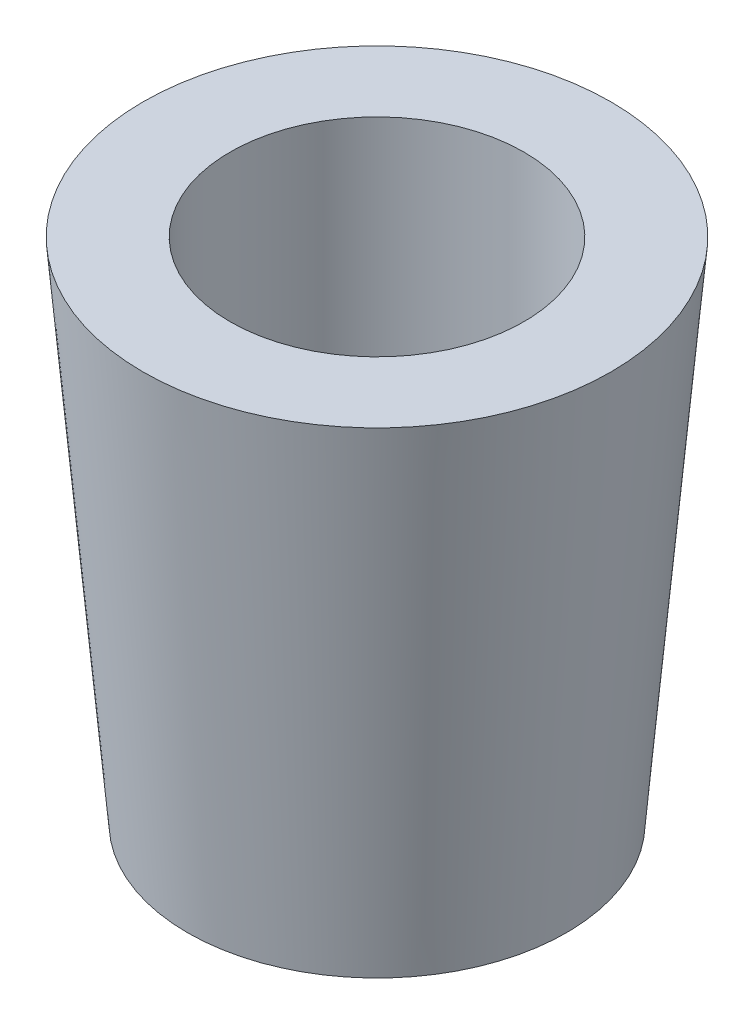
from build123d import *

# Parameters (mm, degrees)
SKETCH1_R           = 11.7
BOSS_EXTRUDE1_DEPTH = 25.4
BOSS_EXTRUDE1_DRAFT = -5
SKETCH2_R           = 3.175
CUT_EXTRUDE1_DEPTH  = 31.314023158
SKETCH9_R           = 7.35
CUT_EXTRUDE3_DEPTH  = 12.7


with BuildPart() as part:
    # Sketch1 → Boss-Extrude1 (with draft: the straight prism first)
    with BuildSketch(Plane(origin=(0, 0, 0), x_dir=(1, 0, 0), z_dir=(0, 1, 0))):
        Circle(SKETCH1_R)
    extrude(amount=-BOSS_EXTRUDE1_DEPTH)
    # Boss-Extrude1: the draft: its side faces are tilted about the plane it starts from
    boss_extrude1_sides = [part.faces().sort_by_distance(p)[0] for p in [
        (-11.7, -12.7, 0),
    ]]
    draft(boss_extrude1_sides, Plane(origin=(0, 0, 0), x_dir=(1, 0, 0), z_dir=(0, 1, 0)), BOSS_EXTRUDE1_DRAFT)

    # Sketch2 → Cut-Extrude1 (cut, through all)
    with BuildSketch(Plane(origin=(0, 0, 0), x_dir=(1, 0, 0), z_dir=(0, 1, 0))):
        Circle(SKETCH2_R)
    extrude(amount=-CUT_EXTRUDE1_DEPTH, mode=Mode.SUBTRACT)

    # Sketch9 → Cut-Extrude3 (cut)
    with BuildSketch(Plane(origin=(0, 0, 0), x_dir=(1, 0, 0), z_dir=(0, 1, 0))):
        Circle(SKETCH9_R)
    extrude(amount=-CUT_EXTRUDE3_DEPTH, mode=Mode.SUBTRACT)


solid = part.part
